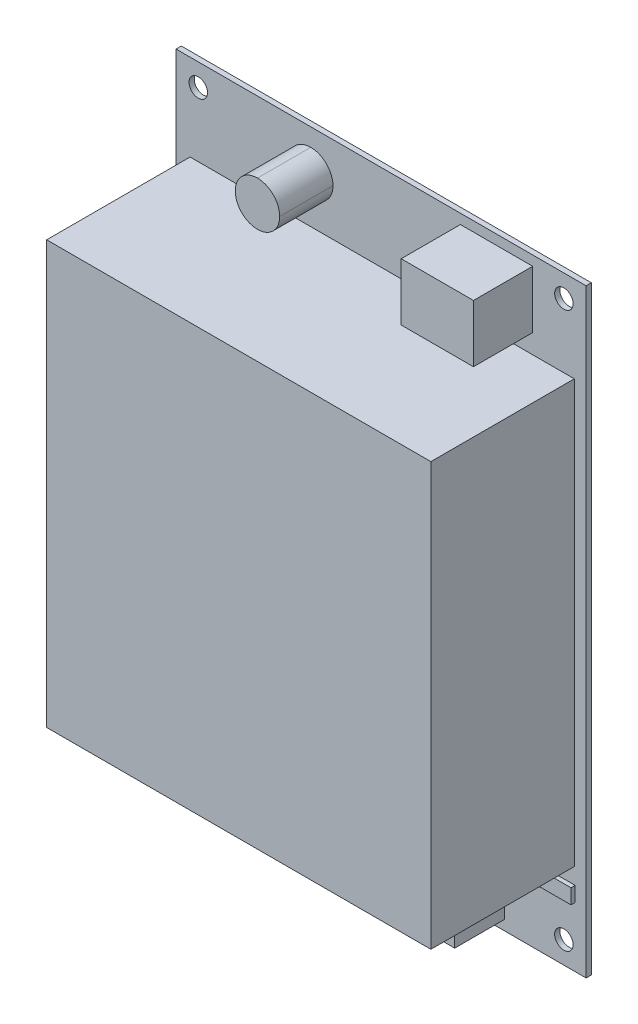
from build123d import *

# Parameters (mm, degrees)
SKETCH1_W                             = 70.358
SKETCH1_H                             = 102.87
BOARD_DEPTH                           = 0.89916
SKETCH48_W                            = 2.54
SKETCH48_H                            = 0.970026
EXTRUDE_0603_R_35_DEPTH               = 0.508
SKETCH49_W                            = 2.54
SKETCH49_H                            = 0.970026
EXTRUDE_0603_R_36_DEPTH               = 0.508
SKETCH50_W                            = 2.54
SKETCH50_H                            = 0.970026
EXTRUDE_0603_R_37_DEPTH               = 0.508
SKETCH59_W                            = 2.54
SKETCH59_H                            = 0.970026
F_0603_RB_1_DEPTH                     = 0.254
SKETCH60_W                            = 2.54
SKETCH60_H                            = 0.970026
EXTRUDE_0603_R_44_DEPTH               = 0.508
SKETCH61_W                            = 2.54
SKETCH61_H                            = 0.970026
F_0603_RA_1_DEPTH                     = 0.254
SKETCH62_W                            = 2.54
SKETCH62_H                            = 0.970026
EXTRUDE_0603_R_45_DEPTH               = 0.508
SKETCH63_W                            = 2.54
SKETCH63_H                            = 0.970026
EXTRUDE_0603_R_46_DEPTH               = 0.508
SKETCH64_W                            = 2.54
SKETCH64_H                            = 0.970026
EXTRUDE_0603_R_47_DEPTH               = 0.508
SKETCH65_W                            = 2.54
SKETCH65_H                            = 0.970026
EXTRUDE_0603_R_48_DEPTH               = 0.508
SKETCH66_W                            = 2.54
SKETCH66_H                            = 0.970026
EXTRUDE_0603_R_49_DEPTH               = 0.508
SKETCH67_W                            = 2.54
SKETCH67_H                            = 0.970026
EXTRUDE_0603_R_50_DEPTH               = 0.508
SKETCH74_W                            = 2.54
SKETCH74_H                            = 0.970026
EXTRUDE_0603_R_56_DEPTH               = 0.508
SKETCH75_W                            = 2.54
SKETCH75_H                            = 0.970026
F_0603_RB_2_DEPTH                     = 0.254
SKETCH78_W                            = 7.62
SKETCH78_H                            = 7.62
SMA_50_TH_1_DEPTH                     = 9.144
SKETCH79_W                            = 7.62
SKETCH79_H                            = 7.62
SMA_50_TH_2_DEPTH                     = 9.144
SKETCH83_W                            = 5.74802
SKETCH83_H                            = 2.54
F_0805_POL_1_DEPTH                    = 0.7112
SKETCH84_W                            = 5.74802
SKETCH84_H                            = 2.54
F_0805_POL_2_DEPTH                    = 0.7112
SKETCH85_W                            = 0.970026
SKETCH85_H                            = 2.54
EXTRUDE_0603_R_58_DEPTH               = 0.508
SKETCH86_W                            = 0.970026
SKETCH86_H                            = 2.54
EXTRUDE_0603_R_59_DEPTH               = 0.508
SKETCH110_W                           = 7.62
SKETCH110_H                           = 7.62
SMA_50_TH_3_DEPTH                     = 9.144
SKETCH117_W                           = 10.499852
SKETCH117_H                           = 6.228588
HDR_SHERLOCK_4P_V_1_DEPTH             = 8.509
SKETCH118_W                           = 12.399772
SKETCH118_H                           = 9.85393
HDR_MFITJR_2R2P_V_1_DEPTH             = 10.16
SKETCH119_W                           = 6.49986
SKETCH119_H                           = 6.304026
HDR_SHERLOCK_2P_V_1_DEPTH             = 8.509
SKETCH121_W                           = 6.354064
SKETCH121_H                           = 3.154172
TSSOP8_1_DEPTH                        = 0.9906
SKETCH122_W                           = 1.778
SKETCH122_H                           = 4.953
EXTRUDE_1206_R_5_DEPTH                = 0.508
SKETCH124_W                           = 5.74802
SKETCH124_H                           = 2.54
F_0805_POL_3_DEPTH                    = 0.7112
SKETCH125_W                           = 5.74802
SKETCH125_H                           = 2.54
F_0805_POL_4_DEPTH                    = 0.7112
SKETCH126_W                           = 2.54
SKETCH126_H                           = 0.970026
EXTRUDE_0603_R_67_DEPTH               = 0.508
SKETCH127_W                           = 2.54
SKETCH127_H                           = 0.970026
EXTRUDE_0603_R_68_DEPTH               = 0.508
SKETCH128_W                           = 0.970026
SKETCH128_H                           = 2.54
EXTRUDE_0603_R_69_DEPTH               = 0.508
SKETCH129_W                           = 0.970026
SKETCH129_H                           = 2.54
EXTRUDE_0603_R_70_DEPTH               = 0.508
SKETCH130_W                           = 9.336024
SKETCH130_H                           = 26.800048
CAP_AXL_18MM_8MM_1_DEPTH              = 12.4968
F_1_8_0_125_DIAMETER_HOLE1_AT_2_COUNT = 2
F_1_8_0_125_DIAMETER_HOLE1_AT_2_PITCH = 62.738
F_1_8_0_125_DIAMETER_HOLE1_AT_3_COUNT = 2
F_1_8_0_125_DIAMETER_HOLE1_AT_3_PITCH = 95.088638299
F_1_8_0_125_DIAMETER_HOLE1_AT_4_COUNT = 2
F_1_8_0_125_DIAMETER_HOLE1_AT_4_PITCH = 114.055333694
SKETCH139_W                           = 65.92772016
SKETCH139_H                           = 72.474474152
EXTRUDE126_DEPTH                      = 24.609143601
FILLET3_R                             = 3.81
FILLET4_R                             = 3.81
FILLET5_R                             = 3.81
FILLET6_R                             = 3.81
FILLET7_R                             = 3.81
FILLET8_R                             = 3.81
FILLET9_R                             = 3.81
FILLET10_R                            = 3.81
FILLET11_R                            = 3.81
FILLET12_R                            = 3.81
FILLET13_R                            = 3.81
FILLET14_R                            = 3.81


with BuildPart() as part:
    # Sketch1 → BOARD (new body)
    with BuildSketch(Plane.XY):
        with Locations((35.179, 51.435)):
            Rectangle(SKETCH1_W, SKETCH1_H)
    extrude(amount=BOARD_DEPTH)

    # Sketch138 → 1/8 (0.125) Diameter Hole1 (revolve, cut)
    with BuildSketch(Plane(origin=(3.81, 99.06, 0.89916), x_dir=(0, -1, 0), z_dir=(1, 0, 0))):
        Polygon((0, 0), (0, 26.353866233), (1.5875, 25.4), (1.5875, 0), align=None)
    f_1_8_0_125_diameter_hole1 = revolve(axis=Axis((3.81, 99.06, 7.24916), (0, 0, -1)), mode=Mode.SUBTRACT)

    # 1/8 (0.125) Diameter Hole1 at 2: 1/8 (0.125) Diameter Hole1 ×2
    with Locations(*[(i * F_1_8_0_125_DIAMETER_HOLE1_AT_2_PITCH, 0, 0) for i in range(1, F_1_8_0_125_DIAMETER_HOLE1_AT_2_COUNT)]):
        add(f_1_8_0_125_diameter_hole1, mode=Mode.SUBTRACT)

    # 1/8 (0.125) Diameter Hole1 at 3: 1/8 (0.125) Diameter Hole1 ×2
    with Locations(*[Vector(-0.001816854216375484, -0.9999983495190162, 0) * (i * F_1_8_0_125_DIAMETER_HOLE1_AT_3_PITCH) for i in range(1, F_1_8_0_125_DIAMETER_HOLE1_AT_3_COUNT)]):
        add(f_1_8_0_125_diameter_hole1, mode=Mode.SUBTRACT)

    # 1/8 (0.125) Diameter Hole1 at 4: 1/8 (0.125) Diameter Hole1 ×2
    with Locations(*[Vector(0.5500663403295117, -0.8351209620387323, 0) * (i * F_1_8_0_125_DIAMETER_HOLE1_AT_4_PITCH) for i in range(1, F_1_8_0_125_DIAMETER_HOLE1_AT_4_COUNT)]):
        add(f_1_8_0_125_diameter_hole1, mode=Mode.SUBTRACT)



with BuildPart() as body_2:
    # Sketch48 → 0603-R-35 (new body)
    with BuildSketch(Plane.XY):
        with Locations((21.717, 50.550953)):
            Rectangle(SKETCH48_W, SKETCH48_H)
    extrude(amount=-EXTRUDE_0603_R_35_DEPTH)


with BuildPart() as body_3:
    # Sketch49 → 0603-R-36 (new body)
    with BuildSketch(Plane.XY):
        with Locations((21.717, 49.148111)):
            Rectangle(SKETCH49_W, SKETCH49_H)
    extrude(amount=-EXTRUDE_0603_R_36_DEPTH)


with BuildPart() as body_4:
    # Sketch50 → 0603-R-37 (new body)
    with BuildSketch(Plane.XY):
        with Locations((21.717, 47.741967)):
            Rectangle(SKETCH50_W, SKETCH50_H)
    extrude(amount=-EXTRUDE_0603_R_37_DEPTH)


with BuildPart() as body_5:
    # Sketch59 → 0603-RB-1 (new body)
    with BuildSketch(Plane.XY):
        with Locations((21.717, 53.335047)):
            Rectangle(SKETCH59_W, SKETCH59_H)
    extrude(amount=-F_0603_RB_1_DEPTH)


with BuildPart() as body_6:
    # Sketch60 → 0603-R-44 (new body)
    with BuildSketch(Plane.XY):
        with Locations((17.907, 50.541047)):
            Rectangle(SKETCH60_W, SKETCH60_H)
    extrude(amount=-EXTRUDE_0603_R_44_DEPTH)


with BuildPart() as body_7:
    # Sketch61 → 0603-RA-1 (new body)
    with BuildSketch(Plane.XY):
        with Locations((17.907, 47.747047)):
            Rectangle(SKETCH61_W, SKETCH61_H)
    extrude(amount=-F_0603_RA_1_DEPTH)


with BuildPart() as body_8:
    # Sketch62 → 0603-R-45 (new body)
    with BuildSketch(Plane.XY):
        with Locations((17.907, 54.741953)):
            Rectangle(SKETCH62_W, SKETCH62_H)
    extrude(amount=-EXTRUDE_0603_R_45_DEPTH)


with BuildPart() as body_9:
    # Sketch63 → 0603-R-46 (new body)
    with BuildSketch(Plane.XY):
        with Locations((17.907, 53.344953)):
            Rectangle(SKETCH63_W, SKETCH63_H)
    extrude(amount=-EXTRUDE_0603_R_46_DEPTH)


with BuildPart() as body_10:
    # Sketch64 → 0603-R-47 (new body)
    with BuildSketch(Plane.XY):
        with Locations((17.907, 56.129047)):
            Rectangle(SKETCH64_W, SKETCH64_H)
    extrude(amount=-EXTRUDE_0603_R_47_DEPTH)


with BuildPart() as body_11:
    # Sketch65 → 0603-R-48 (new body)
    with BuildSketch(Plane.XY):
        with Locations((17.907, 51.938047)):
            Rectangle(SKETCH65_W, SKETCH65_H)
    extrude(amount=-EXTRUDE_0603_R_48_DEPTH)


with BuildPart() as body_12:
    # Sketch66 → 0603-R-49 (new body)
    with BuildSketch(Plane.XY):
        with Locations((21.745448, 51.951001)):
            Rectangle(SKETCH66_W, SKETCH66_H)
    extrude(amount=-EXTRUDE_0603_R_49_DEPTH)


with BuildPart() as body_13:
    # Sketch67 → 0603-R-50 (new body)
    with BuildSketch(Plane.XY):
        with Locations((17.907, 49.153953)):
            Rectangle(SKETCH67_W, SKETCH67_H)
    extrude(amount=-EXTRUDE_0603_R_50_DEPTH)


with BuildPart() as body_14:
    # Sketch74 → 0603-R-56 (new body)
    with BuildSketch(Plane.XY):
        with Locations((21.717, 56.129047)):
            Rectangle(SKETCH74_W, SKETCH74_H)
    extrude(amount=-EXTRUDE_0603_R_56_DEPTH)


with BuildPart() as body_15:
    # Sketch75 → 0603-RB-2 (new body)
    with BuildSketch(Plane.XY):
        with Locations((21.717, 54.732047)):
            Rectangle(SKETCH75_W, SKETCH75_H)
    extrude(amount=-F_0603_RB_2_DEPTH)


with BuildPart() as body_16:
    # Sketch78 → SMA-50-TH-1 (new body)
    with BuildSketch(Plane.XY.offset(0.89916)):
        with Locations((12.827, 6.858)):
            Rectangle(SKETCH78_W, SKETCH78_H)
    extrude(amount=SMA_50_TH_1_DEPTH)

    # Fillet11
    fillet11_edges = [body_16.edges().sort_by_distance(p)[0] for p in [
        (9.017, 3.048, 5.47116),
    ]]
    fillet(fillet11_edges, radius=FILLET11_R)

    # Fillet12
    fillet12_edges = [body_16.edges().sort_by_distance(p)[0] for p in [
        (9.017, 10.668, 5.47116),
    ]]
    fillet(fillet12_edges, radius=FILLET12_R - 0.0001)  # a hair under: the kernel refuses the full size

    # Fillet13
    fillet13_edges = [body_16.edges().sort_by_distance(p)[0] for p in [
        (16.637, 3.048, 5.47116),
    ]]
    fillet(fillet13_edges, radius=FILLET13_R - 0.0001)  # a hair under: the kernel refuses the full size

    # Fillet14
    fillet14_edges = [body_16.edges().sort_by_distance(p)[0] for p in [
        (16.637, 10.668, 5.47116),
    ]]
    fillet(fillet14_edges, radius=FILLET14_R)


with BuildPart() as body_17:
    # Sketch79 → SMA-50-TH-2 (new body)
    with BuildSketch(Plane.XY.offset(0.89916)):
        with Locations((23.114, 96.012)):
            Rectangle(SKETCH79_W, SKETCH79_H)
    extrude(amount=SMA_50_TH_2_DEPTH)

    # Fillet3
    fillet3_edges = [body_17.edges().sort_by_distance(p)[0] for p in [
        (26.924, 92.202, 5.47116),
    ]]
    fillet(fillet3_edges, radius=FILLET3_R)

    # Fillet4
    fillet4_edges = [body_17.edges().sort_by_distance(p)[0] for p in [
        (26.924, 99.822, 5.47116),
    ]]
    fillet(fillet4_edges, radius=FILLET4_R - 0.0001)  # a hair under: the kernel refuses the full size

    # Fillet5
    fillet5_edges = [body_17.edges().sort_by_distance(p)[0] for p in [
        (19.304, 99.822, 5.47116),
    ]]
    fillet(fillet5_edges, radius=FILLET5_R)

    # Fillet6
    fillet6_edges = [body_17.edges().sort_by_distance(p)[0] for p in [
        (19.304, 92.202, 5.47116),
    ]]
    fillet(fillet6_edges, radius=FILLET6_R - 0.0001)  # a hair under: the kernel refuses the full size


with BuildPart() as body_18:
    # Sketch83 → 0805_POL-1 (new body)
    with BuildSketch(Plane.XY.offset(0.89916)):
        with Locations((57.23001, 11.557)):
            Rectangle(SKETCH83_W, SKETCH83_H)
    extrude(amount=F_0805_POL_1_DEPTH)


with BuildPart() as body_19:
    # Sketch84 → 0805_POL-2 (new body)
    with BuildSketch(Plane.XY.offset(0.89916)):
        with Locations((65.61201, 11.557)):
            Rectangle(SKETCH84_W, SKETCH84_H)
    extrude(amount=F_0805_POL_2_DEPTH)


with BuildPart() as body_20:
    # Sketch85 → 0603-R-58 (new body)
    with BuildSketch(Plane.XY.offset(0.89916)):
        with Locations((61.844047, 11.557)):
            Rectangle(SKETCH85_W, SKETCH85_H)
    extrude(amount=EXTRUDE_0603_R_58_DEPTH)


with BuildPart() as body_21:
    # Sketch86 → 0603-R-59 (new body)
    with BuildSketch(Plane.XY.offset(0.89916)):
        with Locations((53.462047, 11.557)):
            Rectangle(SKETCH86_W, SKETCH86_H)
    extrude(amount=EXTRUDE_0603_R_59_DEPTH)


with BuildPart() as body_22:
    # Sketch110 → SMA-50-TH-3 (new body)
    with BuildSketch(Plane.XY.offset(0.89916)):
        with Locations((29.464, 6.858)):
            Rectangle(SKETCH110_W, SKETCH110_H)
    extrude(amount=SMA_50_TH_3_DEPTH)

    # Fillet7
    fillet7_edges = [body_22.edges().sort_by_distance(p)[0] for p in [
        (33.274, 10.668, 5.47116),
    ]]
    fillet(fillet7_edges, radius=FILLET7_R)

    # Fillet8
    fillet8_edges = [body_22.edges().sort_by_distance(p)[0] for p in [
        (33.274, 3.048, 5.47116),
    ]]
    fillet(fillet8_edges, radius=FILLET8_R - 0.0001)  # a hair under: the kernel refuses the full size

    # Fillet9
    fillet9_edges = [body_22.edges().sort_by_distance(p)[0] for p in [
        (25.654, 3.048, 5.47116),
    ]]
    fillet(fillet9_edges, radius=FILLET9_R)

    # Fillet10
    fillet10_edges = [body_22.edges().sort_by_distance(p)[0] for p in [
        (25.654, 10.668, 5.47116),
    ]]
    fillet(fillet10_edges, radius=FILLET10_R - 0.0001)  # a hair under: the kernel refuses the full size


with BuildPart() as body_23:
    # Sketch117 → HDR_SHERLOCK_4P_V-1 (new body)
    with BuildSketch(Plane.XY.offset(0.89916)):
        with Locations((42.242994, 4.782312)):
            Rectangle(SKETCH117_W, SKETCH117_H)
    extrude(amount=HDR_SHERLOCK_4P_V_1_DEPTH)


with BuildPart() as body_24:
    # Sketch118 → HDR_MFITJR_2R2P-V-1 (new body)
    with BuildSketch(Plane.XY.offset(0.89916)):
        with Locations((54.991, 96.255967)):
            Rectangle(SKETCH118_W, SKETCH118_H)
    extrude(amount=HDR_MFITJR_2R2P_V_1_DEPTH)


with BuildPart() as body_25:
    # Sketch119 → HDR_SHERLOCK_2P_V-1 (new body)
    with BuildSketch(Plane.XY.offset(0.89916)):
        with Locations((53.069998, 4.820031)):
            Rectangle(SKETCH119_W, SKETCH119_H)
    extrude(amount=HDR_SHERLOCK_2P_V_1_DEPTH)


with BuildPart() as body_26:
    # Sketch121 → TSSOP8-1 (new body)
    with BuildSketch(Plane.XY):
        with Locations((35.636962, 28.397962)):
            Rectangle(SKETCH121_W, SKETCH121_H)
    extrude(amount=-TSSOP8_1_DEPTH)


with BuildPart() as body_27:
    # Sketch122 → 1206-R-5 (new body)
    with BuildSketch(Plane.XY):
        with Locations((38.0492, 24.0792)):
            Rectangle(SKETCH122_W, SKETCH122_H)
    extrude(amount=-EXTRUDE_1206_R_5_DEPTH)


with BuildPart() as body_28:
    # Sketch124 → 0805_POL-3 (new body)
    with BuildSketch(Plane.XY.offset(0.89916)):
        with Locations((40.46601, 11.557)):
            Rectangle(SKETCH124_W, SKETCH124_H)
    extrude(amount=F_0805_POL_3_DEPTH)


with BuildPart() as body_29:
    # Sketch125 → 0805_POL-4 (new body)
    with BuildSketch(Plane.XY.offset(0.89916)):
        with Locations((48.84801, 11.557)):
            Rectangle(SKETCH125_W, SKETCH125_H)
    extrude(amount=F_0805_POL_4_DEPTH)


with BuildPart() as body_30:
    # Sketch126 → 0603-R-67 (new body)
    with BuildSketch(Plane.XY):
        with Locations((34.3408, 25.852247)):
            Rectangle(SKETCH126_W, SKETCH126_H)
    extrude(amount=-EXTRUDE_0603_R_67_DEPTH)


with BuildPart() as body_31:
    # Sketch127 → 0603-R-68 (new body)
    with BuildSketch(Plane.XY):
        with Locations((41.148, 28.249753)):
            Rectangle(SKETCH127_W, SKETCH127_H)
    extrude(amount=-EXTRUDE_0603_R_68_DEPTH)


with BuildPart() as body_32:
    # Sketch128 → 0603-R-69 (new body)
    with BuildSketch(Plane.XY.offset(0.89916)):
        with Locations((45.080047, 11.557)):
            Rectangle(SKETCH128_W, SKETCH128_H)
    extrude(amount=EXTRUDE_0603_R_69_DEPTH)


with BuildPart() as body_33:
    # Sketch129 → 0603-R-70 (new body)
    with BuildSketch(Plane.XY.offset(0.89916)):
        with Locations((36.707953, 11.557)):
            Rectangle(SKETCH129_W, SKETCH129_H)
    extrude(amount=EXTRUDE_0603_R_70_DEPTH)


with BuildPart() as body_34:
    # Sketch130 → CAP_AXL_18MM_8MM-1 (new body)
    with BuildSketch(Plane.XY.offset(0.89916)):
        with Locations((41.529, 70.837298)):
            Rectangle(SKETCH130_W, SKETCH130_H)
    extrude(amount=CAP_AXL_18MM_8MM_1_DEPTH)


with BuildPart() as part_1:
    add(part.part)

    add(body_34.part)  # Extrude126 merges body 34
    # Sketch139 → Extrude126 (add)
    with BuildSketch(Plane.XY.offset(0.89916)):
        with Locations((35.369298964, 51.791326337)):
            Rectangle(SKETCH139_W, SKETCH139_H)
    extrude(amount=EXTRUDE126_DEPTH)


solid = Compound([body_2.part, body_3.part, body_4.part, body_5.part, body_6.part, body_7.part, body_8.part, body_9.part, body_10.part, body_11.part, body_12.part, body_13.part, body_14.part, body_15.part, body_16.part, body_17.part, body_18.part, body_19.part, body_20.part, body_21.part, body_22.part, body_23.part, body_24.part, body_25.part, body_26.part, body_27.part, body_28.part, body_29.part, body_30.part, body_31.part, body_32.part, body_33.part, part_1.part])
